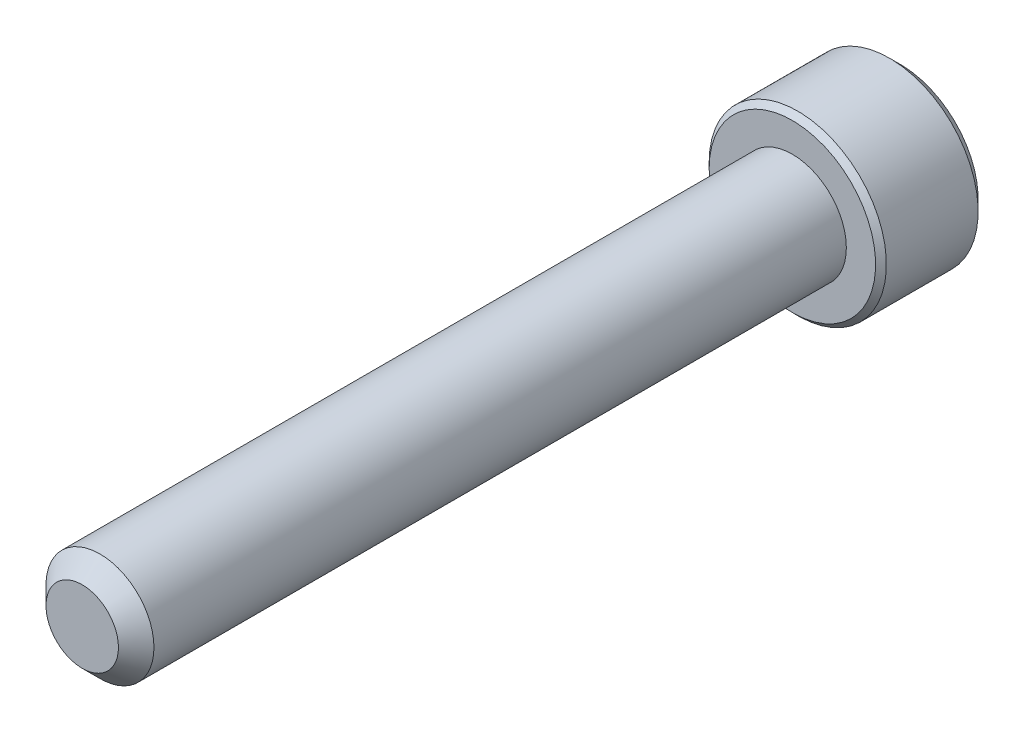
from build123d import *

# Parameters (mm, degrees)
SKETCH1_R          = 2.413
EXTRUDE1_DEPTH     = 31.75
CHAMFER3_SIZE      = 0.79375
SKETCH6_R          = 3.9624
EXTRUDE2_DEPTH     = 4.826
CUT_EXTRUDE1_DEPTH = 2.9765625
SKETCH8_R          = 2.291358881
CUT_EXTRUDE2_DEPTH = 0.4826
CUT_EXTRUDE2_DRAFT = -45
CHAMFER1_SIZE      = 0.4826
CHAMFER2_SIZE      = 0.2413


with BuildPart() as part:
    # Sketch1 → Extrude1 (new body)
    with BuildSketch(Plane.XY):
        Circle(SKETCH1_R)
    extrude(amount=-EXTRUDE1_DEPTH)

    # Chamfer3
    chamfer3_edges = [part.edges().sort_by_distance(p)[0] for p in [
        (-2.413, 0, 0),
    ]]
    chamfer(chamfer3_edges, length=CHAMFER3_SIZE)

    # Sketch5 → partially thread (revolve)
    with BuildSketch(Plane(origin=(0, 0, 0), x_dir=(0, 0, -1), z_dir=(1, 0, 0))):
        Polygon((31.75, 2.413), (22.225, 2.413), (19.812, 0), (22.225, 0), (31.75, 0), align=None)
    revolve(axis=Axis((0, 0, 0), (0, 0, -1)))

    # Sketch6 → Extrude2 (add)
    with BuildSketch(Plane(origin=(0, 0, -31.75), x_dir=(-1, 0, 0), z_dir=(0, 0, -1))):
        Circle(SKETCH6_R)
    extrude(amount=EXTRUDE2_DEPTH)

    # Sketch7 → Cut-Extrude1 (cut)
    with BuildSketch(Plane(origin=(0, 0, -36.576), x_dir=(-1, 0, 0), z_dir=(0, 0, -1))):
        Polygon((0, 2.291358881), (-1.984375, 1.14567944), (-1.984375, -1.14567944), (0, -2.291358881), (1.984375, -1.14567944), (1.984375, 1.14567944), align=None)
    extrude(amount=-CUT_EXTRUDE1_DEPTH, mode=Mode.SUBTRACT)


with BuildPart() as cut_extrude2_tool:
    # Sketch8 → Cut-Extrude2 (with draft: the straight prism first)
    with BuildSketch(Plane(origin=(0, 0, -36.576), x_dir=(-1, 0, 0), z_dir=(0, 0, -1))):
        Circle(SKETCH8_R)
    extrude(amount=-CUT_EXTRUDE2_DEPTH)
    # Cut-Extrude2: the draft: its side faces are tilted about the plane it starts from
    cut_extrude2_sides = [cut_extrude2_tool.faces().sort_by_distance(p)[0] for p in [
        (2.291358881, 0, -36.3347),
    ]]
    draft(cut_extrude2_sides, Plane(origin=(0, 0, -36.576), x_dir=(-1, 0, 0), z_dir=(0, 0, -1)), CUT_EXTRUDE2_DRAFT)


with BuildPart() as part_1:
    add(part.part)

    # Cut-Extrude2: cut by cut_extrude2_tool
    add(cut_extrude2_tool.part, mode=Mode.SUBTRACT)

    # Chamfer1
    chamfer1_edges = [part_1.edges().sort_by_distance(p)[0] for p in [
        (3.9624, 0, -36.576),
    ]]
    chamfer(chamfer1_edges, length=CHAMFER1_SIZE)

    # Chamfer2
    chamfer2_edges = [part_1.edges().sort_by_distance(p)[0] for p in [
        (3.9624, 0, -31.75),
    ]]
    chamfer(chamfer2_edges, length=CHAMFER2_SIZE)


solid = part_1.part
